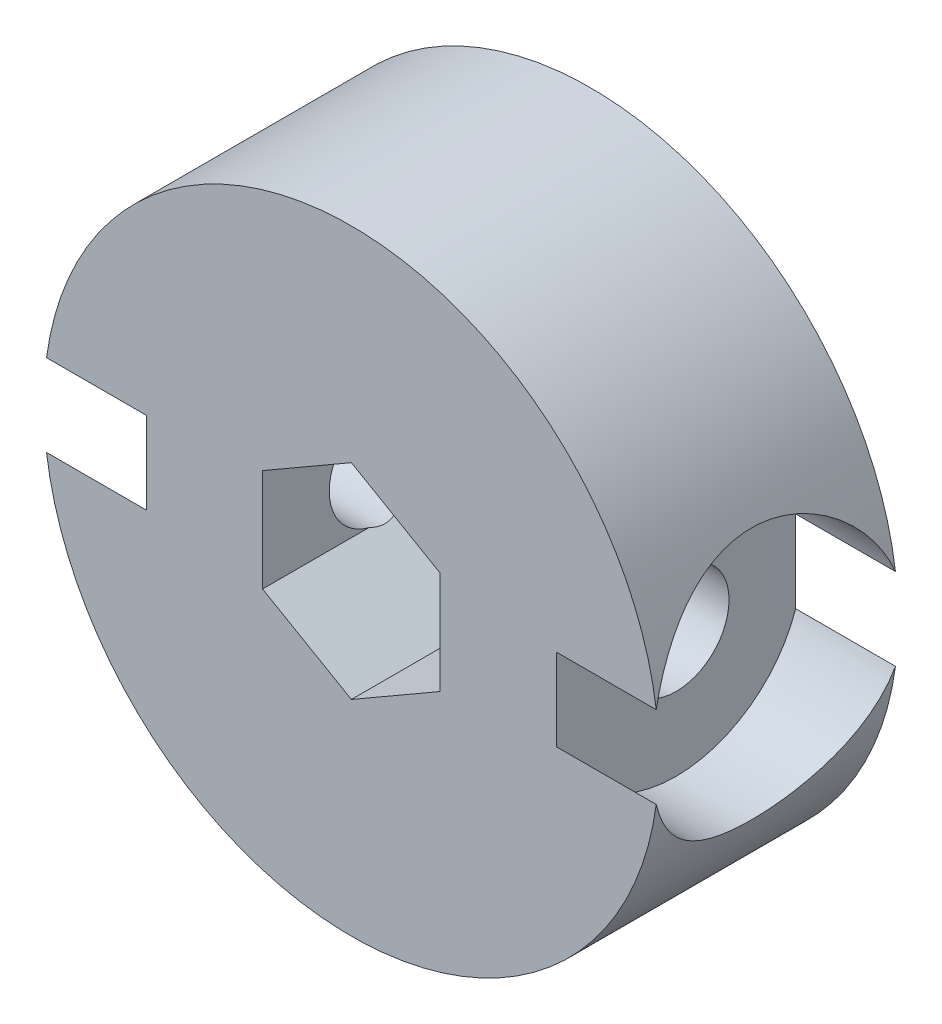
from build123d import *

# Parameters (mm, degrees)
SKETCH1_R               = 9
BOSS_EXTRUDE1_DEPTH     = 7
CUT_EXTRUDE1_DEPTH      = 9
CUT_EXTRUDE1_DEPTH_BACK = 9
SKETCH5_R               = 1.55
SKETCH6_R               = 3.7
CUT_EXTRUDE2_DEPTH      = 5.5
CUT_EXTRUDE3_START      = -5.5
SKETCH7_R               = 3.7
CUT_EXTRUDE3_DEPTH      = 5.5


with BuildPart() as part:
    # Sketch1 → Boss-Extrude1 (new body)
    with BuildSketch(Plane.XY):
        Circle(SKETCH1_R)
        Polygon((0, 3), (2.598076211, 1.5), (2.598076211, -1.5), (0, -3), (-2.598076211, -1.5), (-2.598076211, 1.5), align=None, mode=Mode.SUBTRACT)
    extrude(amount=BOSS_EXTRUDE1_DEPTH)

    # Sketch5 → Cut-Extrude1 (cut, two sides: drawn at the far end of the back side and taken through both)
    with BuildSketch(Plane.ZY.offset(-CUT_EXTRUDE1_DEPTH_BACK)):
        with Locations((3.5, 0)):
            Circle(SKETCH5_R)
    extrude(amount=CUT_EXTRUDE1_DEPTH + CUT_EXTRUDE1_DEPTH_BACK, mode=Mode.SUBTRACT)

    # Sketch6 → Cut-Extrude2 (cut)
    with BuildSketch(Plane.ZY.offset(6)):
        with Locations((3.5, 0)):
            Circle(SKETCH6_R)
    extrude(amount=CUT_EXTRUDE2_DEPTH, mode=Mode.SUBTRACT)

    # Sketch7 → Cut-Extrude3 (cut)
    with BuildSketch(Plane.ZY.offset(-6).offset(CUT_EXTRUDE3_START)):
        with Locations((3.5, 0)):
            Circle(SKETCH7_R)
    extrude(amount=CUT_EXTRUDE3_DEPTH, mode=Mode.SUBTRACT)


solid = part.part
